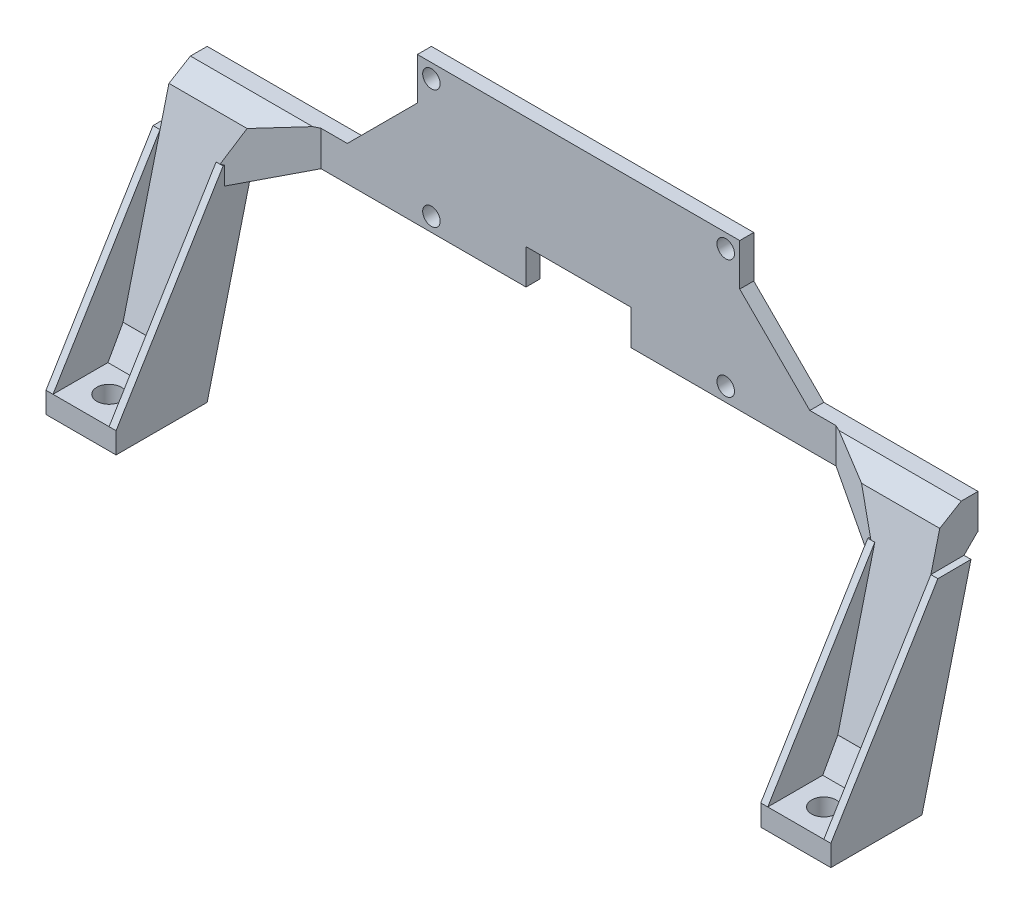
from build123d import *
from OCP.BRepFilletAPI import BRepFilletAPI_MakeChamfer

# Parameters (mm, degrees)
BOSS_EXTRUDE1_DEPTH                        = 2
SKETCH2_R                                  = 1.25
CUT_EXTRUDE1_DEPTH                         = 26.362373706
MIRROR1_AT_THE_SECOND_PLANE_COPY_1_SKETC_R = 1.25
MIRROR1_AT_THE_SECOND_PLANE_COPY_1_DEPTH   = 26.362373706
SKETCH4_W                                  = 32
SKETCH4_H                                  = 5
BOSS_EXTRUDE2_DEPTH                        = 2
SKETCH5_W                                  = 8
SKETCH5_H                                  = 35
BOSS_EXTRUDE3_DEPTH                        = 10
CHAMFER3_SIZE                              = 7
CHAMFER3_SIZE2                             = 28.075466535
CHAMFER2_SIZE                              = 1.9
CHAMFER2_SIZE2                             = 2.60855061
SKETCH6_W                                  = 8
SKETCH6_H                                  = 3
BOSS_EXTRUDE4_DEPTH                        = 10
CHAMFER4_SIZE                              = 3.9
CHAMFER4_SIZE2                             = 2.161805301
CHAMFER3_OF_MIRROR3_SIZE                   = 7
CHAMFER3_OF_MIRROR3_SIZE2                  = 28.075466535
CHAMFER2_OF_MIRROR3_SIZE                   = 1.9
CHAMFER2_OF_MIRROR3_SIZE2                  = 2.60855061
CHAMFER4_OF_MIRROR3_SIZE2                  = 3.9
CHAMFER4_OF_MIRROR3_SIZE                   = 2.161805301
CHAMFER1_SIZE                              = 10
CHAMFER5_SIZE                              = 10.251519208
CHAMFER5_SIZE_2                            = 5
BOSS_EXTRUDE5_DEPTH                        = 1
BOSS_EXTRUDE6_DEPTH                        = 1
SKETCH9_R                                  = 1.75
CUT_EXTRUDE2_DEPTH                         = 77.96752562


with BuildPart() as part:
    # Sketch1 → Boss-Extrude1 (new body)
    with BuildSketch(Plane.XY):
        Polygon((23, 10.5), (-23, 10.5), (-23, -10.5), (-7.5, -10.5), (-7.5, -5.5), (7.5, -5.5), (7.5, -10.5), (23, -10.5), align=None)
    extrude(amount=BOSS_EXTRUDE1_DEPTH)

    # Sketch2 → Cut-Extrude1 (cut, through all)
    with BuildSketch(Plane.XY.offset(2)):
        with Locations((-21, 8.5)):
            Circle(SKETCH2_R)
    cut_extrude1 = extrude(amount=-CUT_EXTRUDE1_DEPTH, mode=Mode.SUBTRACT)

    # Mirror1: Cut-Extrude1 across plane
    add(cut_extrude1.mirror(Plane(origin=(0, 0, 0), x_dir=(0, 0, 1), z_dir=(1, 0, 0))), mode=Mode.SUBTRACT)

    # Mirror1 at the second plane: Cut-Extrude1 across plane
    add(cut_extrude1.mirror(Plane.ZX), mode=Mode.SUBTRACT)

    # Mirror1 at the second plane copy 1 sketc → Mirror1 at the second plane copy 1 (cut, through all)
    with BuildSketch(Plane(origin=(0, 0, 2), x_dir=(-1, 0, 0), z_dir=(0, 0, 1))):
        with Locations((-21, 8.5)):
            Circle(MIRROR1_AT_THE_SECOND_PLANE_COPY_1_SKETC_R)
    extrude(amount=-MIRROR1_AT_THE_SECOND_PLANE_COPY_1_DEPTH, mode=Mode.SUBTRACT)

    # Sketch4 → Boss-Extrude2 (add)
    with BuildSketch(Plane.XY):
        with Locations((-39, -8)):
            Rectangle(SKETCH4_W, SKETCH4_H)
    boss_extrude2 = extrude(amount=BOSS_EXTRUDE2_DEPTH)

    # Sketch5 → Boss-Extrude3 (add)
    with BuildSketch(Plane.XY.offset(2)):
        with Locations((-51, -23)):
            Rectangle(SKETCH5_W, SKETCH5_H)
    boss_extrude3 = extrude(amount=BOSS_EXTRUDE3_DEPTH)

    # Chamfer3: one chamfer whose edges measure the first distance from different faces: ONE call of the kernel's chamfer builder (chamfer() names one face for all edges)
    chamfer3_edges_1 = [part.edges().sort_by_distance(p)[0] for p in [
        (-51, -40.5, 2),
    ]]
    chamfer3_side_1 = [part.faces().sort_by_distance(p)[0] for p in [
        (-51, -40.5, 7),
    ]]
    chamfer3_edges_2 = [part.edges().sort_by_distance(p)[0] for p in [
        (-51, -5.5, 12),
    ]]
    chamfer3_side_2 = [part.faces().sort_by_distance(p)[0] for p in [
        (-54.65823985, -5.5, 6),
    ]]
    chamfer3 = BRepFilletAPI_MakeChamfer(part.part.solid().wrapped)
    for e in chamfer3_edges_1:
        chamfer3.Add(CHAMFER3_SIZE, CHAMFER3_SIZE2, e.wrapped, chamfer3_side_1[0].wrapped)  # the first distance lies on this face
    for e in chamfer3_edges_2:
        chamfer3.Add(CHAMFER3_SIZE, CHAMFER3_SIZE2, e.wrapped, chamfer3_side_2[0].wrapped)  # the first distance lies on this face
    add(Compound.cast(chamfer3.Shape()), mode=Mode.REPLACE)

    # Chamfer2: one chamfer whose edges measure the first distance from different faces: ONE call of the kernel's chamfer builder (chamfer() names one face for all edges)
    chamfer2_edges_1 = [part.edges().sort_by_distance(p)[0] for p in [
        (-51, -10.5, 2),
    ]]
    chamfer2_edges_2 = [part.edges().sort_by_distance(p)[0] for p in [
        (-51, -5.5, 5),
    ]]
    chamfer2_side_2 = [part.faces().sort_by_distance(p)[0] for p in [
        (-51, -19.537733267, 8.5),
    ]]
    chamfer2 = BRepFilletAPI_MakeChamfer(part.part.solid().wrapped)
    for e in chamfer2_edges_1:
        chamfer2.Add(CHAMFER2_SIZE, e.wrapped)
    for e in chamfer2_edges_2:
        chamfer2.Add(CHAMFER2_SIZE, CHAMFER2_SIZE2, e.wrapped, chamfer2_side_2[0].wrapped)  # the first distance lies on this face
    add(Compound.cast(chamfer2.Shape()), mode=Mode.REPLACE)

    # Sketch6 → Boss-Extrude4 (add)
    with BuildSketch(Plane.XY.offset(12)):
        with Locations((-51, -39)):
            Rectangle(SKETCH6_W, SKETCH6_H)
    boss_extrude4 = extrude(amount=BOSS_EXTRUDE4_DEPTH)

    # Chamfer4
    chamfer4_edges = [part.edges().sort_by_distance(p)[0] for p in [
        (-51, -37.5, 12),
    ]]
    chamfer4_side = [part.faces().sort_by_distance(p)[0] for p in [
        (-51, -35.537733267, 12),
    ]]
    chamfer(chamfer4_edges, length=CHAMFER4_SIZE, length2=CHAMFER4_SIZE2, reference=chamfer4_side[0])

    # Mirror3: Boss-Extrude2, Boss-Extrude3, Boss-Extrude4 across plane
    add(boss_extrude2.mirror(Plane(origin=(0, 0, 0), x_dir=(0, 0, 1), z_dir=(1, 0, 0))))
    add(boss_extrude3.mirror(Plane(origin=(0, 0, 0), x_dir=(0, 0, 1), z_dir=(1, 0, 0))))
    add(boss_extrude4.mirror(Plane(origin=(0, 0, 0), x_dir=(0, 0, 1), z_dir=(1, 0, 0))))

    # Chamfer3 of Mirror3: one chamfer whose edges measure the first distance from different faces: ONE call of the kernel's chamfer builder (chamfer() names one face for all edges)
    chamfer3_of_mirror3_edges_1 = [part.edges().sort_by_distance(p)[0] for p in [
        (51, -40.5, 2),
    ]]
    chamfer3_of_mirror3_side_1 = [part.faces().sort_by_distance(p)[0] for p in [
        (51, -40.5, 7),
    ]]
    chamfer3_of_mirror3_edges_2 = [part.edges().sort_by_distance(p)[0] for p in [
        (51, -5.5, 12),
    ]]
    chamfer3_of_mirror3_side_2 = [part.faces().sort_by_distance(p)[0] for p in [
        (54.65823985, -5.5, 6),
    ]]
    chamfer3_of_mirror3 = BRepFilletAPI_MakeChamfer(part.part.solid().wrapped)
    for e in chamfer3_of_mirror3_edges_1:
        chamfer3_of_mirror3.Add(CHAMFER3_OF_MIRROR3_SIZE, CHAMFER3_OF_MIRROR3_SIZE2, e.wrapped, chamfer3_of_mirror3_side_1[0].wrapped)  # the first distance lies on this face
    for e in chamfer3_of_mirror3_edges_2:
        chamfer3_of_mirror3.Add(CHAMFER3_OF_MIRROR3_SIZE, CHAMFER3_OF_MIRROR3_SIZE2, e.wrapped, chamfer3_of_mirror3_side_2[0].wrapped)  # the first distance lies on this face
    add(Compound.cast(chamfer3_of_mirror3.Shape()), mode=Mode.REPLACE)

    # Chamfer2 of Mirror3: one chamfer whose edges measure the first distance from different faces: ONE call of the kernel's chamfer builder (chamfer() names one face for all edges)
    chamfer2_of_mirror3_edges_1 = [part.edges().sort_by_distance(p)[0] for p in [
        (51, -10.5, 2),
    ]]
    chamfer2_of_mirror3_edges_2 = [part.edges().sort_by_distance(p)[0] for p in [
        (51, -5.5, 5),
    ]]
    chamfer2_of_mirror3_side_2 = [part.faces().sort_by_distance(p)[0] for p in [
        (51, -19.537733267, 8.5),
    ]]
    chamfer2_of_mirror3 = BRepFilletAPI_MakeChamfer(part.part.solid().wrapped)
    for e in chamfer2_of_mirror3_edges_1:
        chamfer2_of_mirror3.Add(CHAMFER2_OF_MIRROR3_SIZE, e.wrapped)
    for e in chamfer2_of_mirror3_edges_2:
        chamfer2_of_mirror3.Add(CHAMFER2_OF_MIRROR3_SIZE, CHAMFER2_OF_MIRROR3_SIZE2, e.wrapped, chamfer2_of_mirror3_side_2[0].wrapped)  # the first distance lies on this face
    add(Compound.cast(chamfer2_of_mirror3.Shape()), mode=Mode.REPLACE)

    # Chamfer4 of Mirror3
    chamfer4_of_mirror3_edges = [part.edges().sort_by_distance(p)[0] for p in [
        (51, -37.5, 12),
    ]]
    chamfer(chamfer4_of_mirror3_edges, length=CHAMFER4_OF_MIRROR3_SIZE, length2=CHAMFER4_OF_MIRROR3_SIZE2)

    # Chamfer1
    chamfer1_edges = [part.edges().sort_by_distance(p)[0] for p in [
        (23, -5.5, 1),
        (-23, -5.5, 1),
    ]]
    chamfer(chamfer1_edges, length=CHAMFER1_SIZE)

    # Chamfer5
    # the kernel refuses this chamfer: 10.251519208, 5 mm, written as the material it adds along each edge
    with BuildSketch(Plane(origin=(-47, -10.5, 28.554001508), x_dir=(1, 0, 0), z_dir=(0, 0, -1))) as chamfer5_piece_1_section:
        Polygon((CHAMFER5_SIZE, 0), (0, CHAMFER5_SIZE_2), (0, 0), align=None)
    chamfer5_piece_1 = extrude(amount=55.008003016, mode=Mode.PRIVATE)
    chamfer5_piece_1 = split(chamfer5_piece_1, bisect_by=Plane(origin=(-47, -16.84580993, 3.102348031), z_dir=(0, 0.24192189559966532, 0.9702957262759971)), keep=Keep.TOP, mode=Mode.PRIVATE)
    chamfer5_piece_1 = split(chamfer5_piece_1, bisect_by=Plane(origin=(-47, -10.5, 2), z_dir=(0, 0, 1)), keep=Keep.TOP, mode=Mode.PRIVATE)
    chamfer5_piece_1 = split(chamfer5_piece_1, bisect_by=Plane(origin=(-47, -24.727000754, 14.327000754), z_dir=(0, -0.7071067811865475, -0.7071067811865477)), keep=Keep.TOP, mode=Mode.PRIVATE)
    add(chamfer5_piece_1)
    with BuildSketch(Plane(origin=(-47, -10.5, 2), x_dir=(1, 0, 0), z_dir=(0, 0, -1))) as chamfer5_piece_2_section:
        Polygon((CHAMFER5_SIZE, 0), (0, CHAMFER5_SIZE_2), (0, 0), align=None)
    chamfer5_piece_2 = extrude(amount=28.454001508, mode=Mode.PRIVATE)
    chamfer5_piece_2 = split(chamfer5_piece_2, bisect_by=Plane(origin=(-47, -11.45, 1.05), z_dir=(0, 0.7071067811865475, 0.7071067811865477)), keep=Keep.TOP, mode=Mode.PRIVATE)
    add(chamfer5_piece_2)
    with BuildSketch(Plane(origin=(-47, -5.5, 2), x_dir=(1, 0, 0), z_dir=(0, -1, 0))) as chamfer5_piece_3_section:
        Polygon((CHAMFER5_SIZE, 0), (0, CHAMFER5_SIZE_2), (0, 0), align=None)
    chamfer5_piece_3 = extrude(amount=5, mode=Mode.PRIVATE)
    chamfer5_piece_3 = split(chamfer5_piece_3, bisect_by=Plane(origin=(-47, -5.327185351, 2.103837517), z_dir=(0, -0.8571673007021119, -0.5150380749100548)), keep=Keep.TOP, mode=Mode.PRIVATE)
    chamfer5_piece_3 = split(chamfer5_piece_3, bisect_by=Plane(origin=(-47, -4.795792656, 4.824421389), z_dir=(0, -0.24192189559966532, -0.9702957262759971)), keep=Keep.TOP, mode=Mode.PRIVATE)
    add(chamfer5_piece_3)
    with BuildSketch(Plane(origin=(47, -5.5, 2), x_dir=(-1, 0, 0), z_dir=(0, -1, 0))) as chamfer5_piece_4_section:
        Polygon((CHAMFER5_SIZE, 0), (0, -CHAMFER5_SIZE_2), (0, 0), align=None)
    chamfer5_piece_4 = extrude(amount=5, mode=Mode.PRIVATE)
    chamfer5_piece_4 = split(chamfer5_piece_4, bisect_by=Plane(origin=(47, -5.327185351, 2.103837517), z_dir=(0, -0.8571673007021119, -0.5150380749100548)), keep=Keep.TOP, mode=Mode.PRIVATE)
    chamfer5_piece_4 = split(chamfer5_piece_4, bisect_by=Plane(origin=(47, -4.795792656, 4.824421389), z_dir=(0, -0.24192189559966532, -0.9702957262759971)), keep=Keep.TOP, mode=Mode.PRIVATE)
    add(chamfer5_piece_4)
    with BuildSketch(Plane(origin=(47, -10.5, 2), x_dir=(0, -1, 0), z_dir=(0, 0, -1))) as chamfer5_piece_5_section:
        Polygon((CHAMFER5_SIZE_2, 0), (0, CHAMFER5_SIZE), (0, 0), align=None)
    chamfer5_piece_5 = extrude(amount=28.454001508, mode=Mode.PRIVATE)
    chamfer5_piece_5 = split(chamfer5_piece_5, bisect_by=Plane(origin=(47, -11.45, 1.05), z_dir=(0, 0.7071067811865475, 0.7071067811865477)), keep=Keep.TOP, mode=Mode.PRIVATE)
    add(chamfer5_piece_5)
    with BuildSketch(Plane(origin=(47, -10.5, 28.554001508), x_dir=(0, -1, 0), z_dir=(0, 0, -1))) as chamfer5_piece_6_section:
        Polygon((CHAMFER5_SIZE_2, 0), (0, CHAMFER5_SIZE), (0, 0), align=None)
    chamfer5_piece_6 = extrude(amount=55.008003016, mode=Mode.PRIVATE)
    chamfer5_piece_6 = split(chamfer5_piece_6, bisect_by=Plane(origin=(47, -16.84580993, 3.102348031), z_dir=(0, 0.24192189559966532, 0.9702957262759971)), keep=Keep.TOP, mode=Mode.PRIVATE)
    chamfer5_piece_6 = split(chamfer5_piece_6, bisect_by=Plane(origin=(47, -10.5, 2), z_dir=(0, 0, 1)), keep=Keep.TOP, mode=Mode.PRIVATE)
    chamfer5_piece_6 = split(chamfer5_piece_6, bisect_by=Plane(origin=(47, -24.727000754, 14.327000754), z_dir=(0, -0.7071067811865475, -0.7071067811865477)), keep=Keep.TOP, mode=Mode.PRIVATE)
    add(chamfer5_piece_6)
    with BuildSketch(Plane(origin=(-47, -5.5, 2), x_dir=(1, 0, 0), z_dir=(0, -1, 0))) as chamfer5_piece_7a_section:
        Polygon((CHAMFER5_SIZE, 0), (0, CHAMFER5_SIZE_2), (0, 0), align=None)
    chamfer5_piece_7a = extrude(amount=31.554001508, mode=Mode.PRIVATE)
    chamfer5_piece_7a = split(chamfer5_piece_7a, bisect_by=Plane(origin=(-47, -10.5, 2), z_dir=(0, -1, 0)), keep=Keep.TOP, mode=Mode.PRIVATE)
    chamfer5_piece_7a = split(chamfer5_piece_7a, bisect_by=Plane(origin=(-47, -4.795792656, 4.824421389), z_dir=(0, -0.24192189559966532, -0.9702957262759971)), keep=Keep.TOP, mode=Mode.PRIVATE)
    chamfer5_piece_7a = split(chamfer5_piece_7a, bisect_by=Plane(origin=(-47, -8.95, -1.45), z_dir=(0, 0.7071067811865475, 0.7071067811865477)), keep=Keep.TOP, mode=Mode.PRIVATE)
    with BuildSketch(Plane(origin=(-47, -10.5, 28.554001508), x_dir=(1, 0, 0), z_dir=(0, 0, -1))) as chamfer5_piece_7b_section:
        Polygon((CHAMFER5_SIZE, 0), (0, CHAMFER5_SIZE_2), (0, 0), align=None)
    chamfer5_piece_7b = extrude(amount=55.008003016, mode=Mode.PRIVATE)
    chamfer5_piece_7b = split(chamfer5_piece_7b, bisect_by=Plane(origin=(-47, -15.736335931, 7.552205194), z_dir=(0, -0.24192189559966532, -0.9702957262759971)), keep=Keep.TOP, mode=Mode.PRIVATE)
    chamfer5_piece_7b = split(chamfer5_piece_7b, bisect_by=Plane(origin=(-47, -10.5, 2), z_dir=(0, 0, 1)), keep=Keep.TOP, mode=Mode.PRIVATE)
    chamfer5_piece_7b = split(chamfer5_piece_7b, bisect_by=Plane(origin=(-47, -24.727000754, 14.327000754), z_dir=(0, 0.7071067811865475, 0.7071067811865477)), keep=Keep.TOP, mode=Mode.PRIVATE)
    chamfer5_piece_7 = chamfer5_piece_7a & chamfer5_piece_7b
    add(chamfer5_piece_7)
    with BuildSketch(Plane(origin=(47, -5.5, 2), x_dir=(-1, 0, 0), z_dir=(0, -1, 0))) as chamfer5_piece_8a_section:
        Polygon((CHAMFER5_SIZE, 0), (0, -CHAMFER5_SIZE_2), (0, 0), align=None)
    chamfer5_piece_8a = extrude(amount=31.554001508, mode=Mode.PRIVATE)
    chamfer5_piece_8a = split(chamfer5_piece_8a, bisect_by=Plane(origin=(47, -10.5, 2), z_dir=(0, -1, 0)), keep=Keep.TOP, mode=Mode.PRIVATE)
    chamfer5_piece_8a = split(chamfer5_piece_8a, bisect_by=Plane(origin=(47, -4.795792656, 4.824421389), z_dir=(0, -0.24192189559966532, -0.9702957262759971)), keep=Keep.TOP, mode=Mode.PRIVATE)
    chamfer5_piece_8a = split(chamfer5_piece_8a, bisect_by=Plane(origin=(47, -8.95, -1.45), z_dir=(0, 0.7071067811865475, 0.7071067811865477)), keep=Keep.TOP, mode=Mode.PRIVATE)
    with BuildSketch(Plane(origin=(47, -10.5, 28.554001508), x_dir=(0, -1, 0), z_dir=(0, 0, -1))) as chamfer5_piece_8b_section:
        Polygon((CHAMFER5_SIZE_2, 0), (0, CHAMFER5_SIZE), (0, 0), align=None)
    chamfer5_piece_8b = extrude(amount=55.008003016, mode=Mode.PRIVATE)
    chamfer5_piece_8b = split(chamfer5_piece_8b, bisect_by=Plane(origin=(47, -15.736335931, 7.552205194), z_dir=(0, -0.24192189559966532, -0.9702957262759971)), keep=Keep.TOP, mode=Mode.PRIVATE)
    chamfer5_piece_8b = split(chamfer5_piece_8b, bisect_by=Plane(origin=(47, -10.5, 2), z_dir=(0, 0, 1)), keep=Keep.TOP, mode=Mode.PRIVATE)
    chamfer5_piece_8b = split(chamfer5_piece_8b, bisect_by=Plane(origin=(47, -24.727000754, 14.327000754), z_dir=(0, 0.7071067811865475, 0.7071067811865477)), keep=Keep.TOP, mode=Mode.PRIVATE)
    chamfer5_piece_8 = chamfer5_piece_8a & chamfer5_piece_8b
    add(chamfer5_piece_8)

    # Sketch7 → Boss-Extrude5 (add)
    with BuildSketch(Plane.ZY.offset(-47)):
        Polygon((22, -40.5), (9, -40.5), (2, -12.424533465), (6.7264801, -12.424533465), (22, -37.5), align=None)
    boss_extrude5 = extrude(amount=BOSS_EXTRUDE5_DEPTH)

    # Sketch8 → Boss-Extrude6 (add)
    with BuildSketch(Plane(origin=(55, 0, 0), x_dir=(0, 0, -1), z_dir=(1, 0, 0))):
        Polygon((-22, -37.5), (-22, -40.5), (-9, -40.5), (-2, -12.4), (-6.7264801, -12.424533465), align=None)
    boss_extrude6 = extrude(amount=BOSS_EXTRUDE6_DEPTH)

    # Mirror4: Boss-Extrude5, Boss-Extrude6 across plane
    add(boss_extrude5.mirror(Plane(origin=(0, 0, 0), x_dir=(0, 0, 1), z_dir=(1, 0, 0))))
    add(boss_extrude6.mirror(Plane(origin=(0, 0, 0), x_dir=(0, 0, 1), z_dir=(1, 0, 0))))

    # Sketch9 → Cut-Extrude2 (cut, through all)
    with BuildSketch(Plane(origin=(0, -37.5, 0), x_dir=(1, 0, 0), z_dir=(0, 1, 0))):
        with Locations(Location((-51, -18, 0), (0, 0, 270))):
            Circle(SKETCH9_R)
        with Locations(Location((51, -18, 0), (0, 0, 270))):
            Circle(SKETCH9_R)
    extrude(amount=-CUT_EXTRUDE2_DEPTH, mode=Mode.SUBTRACT)


solid = part.part
